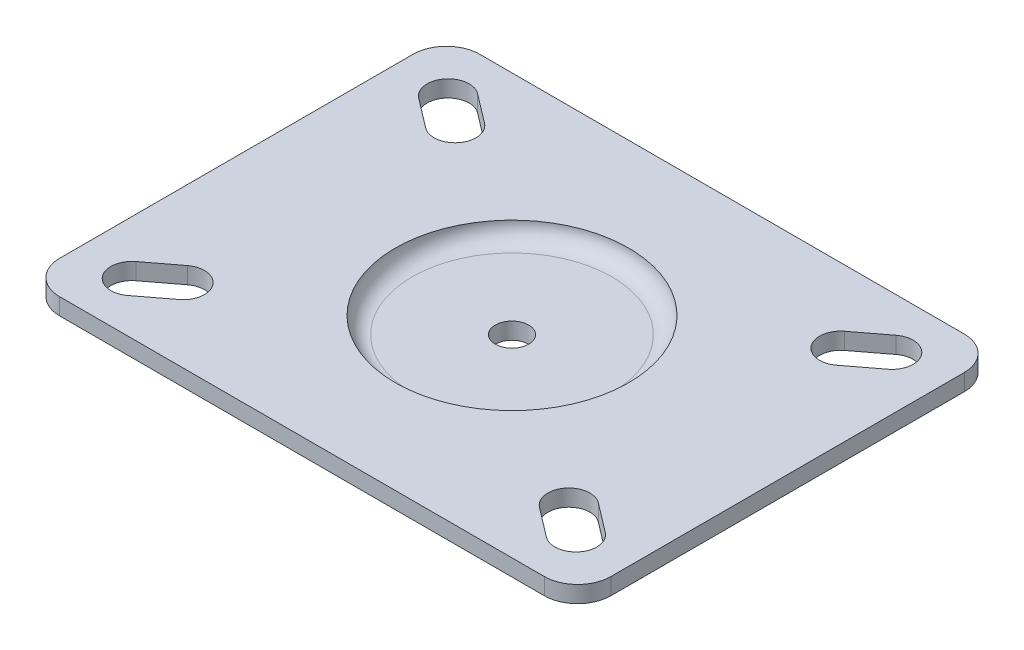
from build123d import *

# Parameters (mm, degrees)
SKETCH12_W          = 105
SKETCH12_H          = 80
BOSS_EXTRUDE6_DEPTH = 3.175
SKETCH15_R          = 25.4
BOSS_EXTRUDE7_DEPTH = 6.35
SKETCH16_R          = 22.225
CUT_EXTRUDE3_DEPTH  = 3.175
CUT_EXTRUDE2_REACH  = 68.307
SKETCH14_R          = 3.175
FILLET6_R           = 6.35
FILLET7_R           = 3.175


with BuildPart() as part:
    # Sketch12 → Boss-Extrude6 (new body)
    with BuildSketch(Plane(origin=(0, 0, 0), x_dir=(-1, 0, 0), z_dir=(0, 1, 0))):
        Rectangle(SKETCH12_W, SKETCH12_H)
    extrude(amount=BOSS_EXTRUDE6_DEPTH)

    # Sketch15 → Boss-Extrude7 (add)
    with BuildSketch(Plane(origin=(0, 3.175, 0), x_dir=(1, 0, 0), z_dir=(0, 1, 0))):
        with Locations(Location((0, 0, 0), (0, 0, 270))):
            Circle(SKETCH15_R)
    extrude(amount=-BOSS_EXTRUDE7_DEPTH)

    # Sketch16 → Cut-Extrude3 (cut)
    with BuildSketch(Plane(origin=(0, 3.175, 0), x_dir=(1, 0, 0), z_dir=(0, 1, 0))):
        with Locations(Location((0, 0, 0), (0, 0, 270))):
            Circle(SKETCH16_R)
    extrude(amount=-CUT_EXTRUDE3_DEPTH, mode=Mode.SUBTRACT)

    # Sketch14 → Cut-Extrude2 (cut, up to next)
    with BuildSketch(Plane(origin=(0, 3.175, 0), x_dir=(-1, 0, 0), z_dir=(0, 1, 0)), mode=Mode.PRIVATE) as cut_extrude2_sk1:
        with Locations(Location((0, 0, 0), (0, 0, 90))):
            Circle(SKETCH14_R)
    cut_extrude2_tool1 = extrude(cut_extrude2_sk1.sketch, amount=-CUT_EXTRUDE2_REACH, mode=Mode.PRIVATE) & part.part
    # Sketch14 → Cut-Extrude2 (cut, up to next)
    with BuildSketch(Plane(origin=(0, 3.175, 0), x_dir=(-1, 0, 0), z_dir=(0, 1, 0)), mode=Mode.PRIVATE) as cut_extrude2_sk2:
        with BuildLine():
            Line((44.708183881, 26.939424373), (39.140161841, 22.697121866))
            ThreePointArc((39.140161841, 22.697121866), (33.5342621, 23.454675886), (34.291816119, 29.060575627))
            Line((34.291816119, 29.060575627), (39.859838159, 33.302878134))
            ThreePointArc((39.859838159, 33.302878134), (45.4657379, 32.545324114), (44.708183881, 26.939424373))
        make_face()
    cut_extrude2_tool2 = extrude(cut_extrude2_sk2.sketch, amount=-CUT_EXTRUDE2_REACH, mode=Mode.PRIVATE) & part.part
    # Sketch14 → Cut-Extrude2 (cut, up to next)
    with BuildSketch(Plane(origin=(0, 3.175, 0), x_dir=(-1, 0, 0), z_dir=(0, 1, 0)), mode=Mode.PRIVATE) as cut_extrude2_sk3:
        with BuildLine():
            Line((-44.708183881, 26.939424373), (-39.140161841, 22.697121866))
            ThreePointArc((-39.140161841, 22.697121866), (-33.5342621, 23.454675886), (-34.291816119, 29.060575627))
            Line((-34.291816119, 29.060575627), (-39.859838159, 33.302878134))
            ThreePointArc((-39.859838159, 33.302878134), (-45.4657379, 32.545324114), (-44.708183881, 26.939424373))
        make_face()
    cut_extrude2_tool3 = extrude(cut_extrude2_sk3.sketch, amount=-CUT_EXTRUDE2_REACH, mode=Mode.PRIVATE) & part.part
    # Sketch14 → Cut-Extrude2 (cut, up to next)
    with BuildSketch(Plane(origin=(0, 3.175, 0), x_dir=(-1, 0, 0), z_dir=(0, 1, 0)), mode=Mode.PRIVATE) as cut_extrude2_sk4:
        with BuildLine():
            Line((-44.708183881, -26.939424373), (-39.140161841, -22.697121866))
            ThreePointArc((-39.140161841, -22.697121866), (-33.5342621, -23.454675886), (-34.291816119, -29.060575627))
            Line((-34.291816119, -29.060575627), (-39.859838159, -33.302878134))
            ThreePointArc((-39.859838159, -33.302878134), (-45.4657379, -32.545324114), (-44.708183881, -26.939424373))
        make_face()
    cut_extrude2_tool4 = extrude(cut_extrude2_sk4.sketch, amount=-CUT_EXTRUDE2_REACH, mode=Mode.PRIVATE) & part.part
    # Sketch14 → Cut-Extrude2 (cut, up to next)
    with BuildSketch(Plane(origin=(0, 3.175, 0), x_dir=(-1, 0, 0), z_dir=(0, 1, 0)), mode=Mode.PRIVATE) as cut_extrude2_sk5:
        with BuildLine():
            Line((44.708183881, -26.939424373), (39.140161841, -22.697121866))
            ThreePointArc((39.140161841, -22.697121866), (33.5342621, -23.454675886), (34.291816119, -29.060575627))
            Line((34.291816119, -29.060575627), (39.859838159, -33.302878134))
            ThreePointArc((39.859838159, -33.302878134), (45.4657379, -32.545324114), (44.708183881, -26.939424373))
        make_face()
    cut_extrude2_tool5 = extrude(cut_extrude2_sk5.sketch, amount=-CUT_EXTRUDE2_REACH, mode=Mode.PRIVATE) & part.part
    add(cut_extrude2_tool1.solids().sort_by_distance((0, 3.175, 0))[0], mode=Mode.SUBTRACT)
    add(cut_extrude2_tool2.solids().sort_by_distance((-39.5, 3.175, 28))[0], mode=Mode.SUBTRACT)
    add(cut_extrude2_tool3.solids().sort_by_distance((39.5, 3.175, 28))[0], mode=Mode.SUBTRACT)
    add(cut_extrude2_tool4.solids().sort_by_distance((39.5, 3.175, -28))[0], mode=Mode.SUBTRACT)
    add(cut_extrude2_tool5.solids().sort_by_distance((-39.5, 3.175, -28))[0], mode=Mode.SUBTRACT)

    # Fillet6
    fillet6_edges = [part.edges().sort_by_distance(p)[0] for p in [
        (52.5, 1.5875, 40),
        (-52.5, 1.5875, 40),
        (-52.5, 1.5875, -40),
        (52.5, 1.5875, -40),
    ]]
    fillet(fillet6_edges, radius=FILLET6_R)

    # Fillet7
    fillet7_edges = [part.edges().sort_by_distance(p)[0] for p in [
        (0, -3.175, -25.4),
        (0, 0, -22.225),
    ]]
    fillet(fillet7_edges, radius=FILLET7_R - 0.0001)  # a hair under: the kernel refuses the full size


solid = part.part
